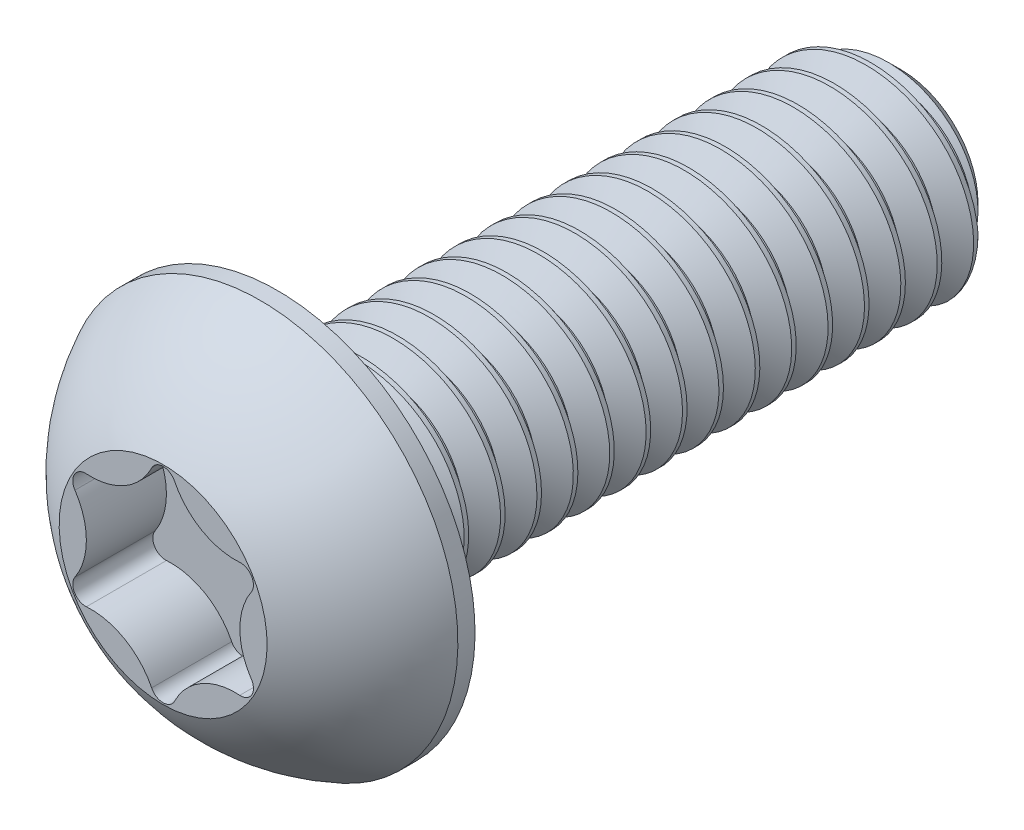
from build123d import *

# Parameters (mm, degrees)
SKETCH12_W         = 12
SKETCH12_H         = 2
CUT_EXTRUDE4_DEPTH = 1.54
CIRPATTERN1_COUNT  = 6
CHAMFER1_SIZE      = 0.525
CUT_SWEEP1_PITCH   = 0.7
CUT_SWEEP1_TO      = 12


with BuildPart() as part:
    # Sketch12 → Revolve1 (revolve)
    with BuildSketch(Plane(origin=(0, 0, 0), x_dir=(0, 0, -1), z_dir=(1, 0, 0))):
        with Locations((0, 1)):
            Rectangle(SKETCH12_W, SKETCH12_H)
    revolve(axis=Axis((0, 0, -6), (0, 0, 1)))

    # Sketch7 → Revolve2 (revolve)
    with BuildSketch(Plane(origin=(0, 0, 0), x_dir=(0, 0, -1), z_dir=(1, 0, 0)), mode=Mode.PRIVATE) as revolve2_sk:
        with BuildLine():
            Line((-6.33, 3.8), (-6, 3.8))
            Line((-6, 3.8), (-6, 0))
            Line((-6, 0), (-8.2, 0))
            Line((-8.2, 0), (-8.2, 2))
            ThreePointArc((-8.2, 2), (-7.406499853, 3.047002626), (-6.33, 3.8))
        make_face()
    revolve(revolve2_sk.sketch.rotate(Axis((0, 0, 8.2), (0, 0, -1)), 180), axis=Axis((0, 0, 8.2), (0, 0, -1)))

    # Sketch11 → Cut-Extrude4 (cut)
    with BuildSketch(Plane.XY.offset(8.2)):
        with BuildLine():
            Line((0, 0), (-1.704771007, 0.98425))
            ThreePointArc((-1.704771007, 0.98425), (-1.737604406, 0.853137928), (-1.696234895, 0.724464034))
            ThreePointArc((-1.696234895, 0.724464034), (-1.476375, 0), (-1.696234895, -0.724464034))
            ThreePointArc((-1.696234895, -0.724464034), (-1.737604406, -0.853137928), (-1.704771007, -0.98425))
            Line((-1.704771007, -0.98425), (0, 0))
        make_face()
    cut_extrude4 = extrude(amount=-CUT_EXTRUDE4_DEPTH, mode=Mode.SUBTRACT)

    # CirPattern1: Cut-Extrude4 ×6 about axis
    cirpattern1_axis = Axis((0, 0, 0), (0, 0, -1))
    for i in range(1, CIRPATTERN1_COUNT):
        add(cut_extrude4.rotate(cirpattern1_axis, i * 360 / CIRPATTERN1_COUNT), mode=Mode.SUBTRACT)

    # Chamfer1
    chamfer1_edges = [part.edges().sort_by_distance(p)[0] for p in [
        (0, -2, -6),
    ]]
    chamfer(chamfer1_edges, length=CHAMFER1_SIZE)


with BuildPart() as body_2:
    # Split1: read off the stored shape, not the designer's step
    # Split1: the piece on the far side of the plane
    add(part.part)
    split(bisect_by=Plane.XY.offset(6), keep=Keep.BOTTOM)

    # Cut-Sweep1: arcs per turn and ends read off the stored shape
    # Cut-Sweep1: the profile of Sketch14 screwed along a right-hand helix through 18.142857 turns, 6 arcs to a turn; built about Z, then put on its axis
    cut_sweep1_z = Axis((0, 0, 0), (0, 0, 1))
    cut_sweep1_corners = [(1.545336663, 0, -0.2625), (2.037888611, 0, 0.021875), (2.037888611, 0, -0.634375), (1.545336663, 0, -0.35)]
    with BuildLine(mode=Mode.PRIVATE) as cut_sweep1_profile:
        Line(cut_sweep1_corners[0], cut_sweep1_corners[1])
        Line(cut_sweep1_corners[1], cut_sweep1_corners[2])
        Line(cut_sweep1_corners[2], cut_sweep1_corners[3])
        Line(cut_sweep1_corners[3], cut_sweep1_corners[0])
    cut_sweep1_cap = Face(cut_sweep1_profile.wire())
    cut_sweep1_turn_angles = [0, 30, 60, 90, 120, 150, 180, 210, 240, 270, 300, 330, 360]
    cut_sweep1_turn_weights = [1, 0.8660254037844387, 1, 0.8660254037844387, 1, 0.8660254037844387, 1, 0.8660254037844387, 1, 0.8660254037844387, 1, 0.8660254037844387, 1]
    cut_sweep1_turn_rails = [Edge.make_bspline([Vector(p[0], p[1], 0).rotate(cut_sweep1_z, cut_sweep1_turn_angles[k]) / cut_sweep1_turn_weights[k] + Vector(0, 0, p[2] + CUT_SWEEP1_PITCH * cut_sweep1_turn_angles[k] / 360) for k in range(13)], [0, 0, 0, 1, 1, 2, 2, 3, 3, 4, 4, 5, 5, 6, 6, 6], 2, cut_sweep1_turn_weights) for p in cut_sweep1_corners]
    cut_sweep1_turn_sides = [Face.make_surface_from_curves(cut_sweep1_turn_rails[p[0]], cut_sweep1_turn_rails[p[1]]) for p in [(0, 1), (1, 2), (2, 3), (3, 0)]]
    cut_sweep1_last_angles = [6480, 6505.714285714, 6531.428571429]
    cut_sweep1_last_weights = [1, 0.9009688679025564, 1]
    cut_sweep1_last_rails = [Edge.make_bspline([Vector(p[0], p[1], 0).rotate(cut_sweep1_z, cut_sweep1_last_angles[k]) / cut_sweep1_last_weights[k] + Vector(0, 0, p[2] + CUT_SWEEP1_PITCH * cut_sweep1_last_angles[k] / 360) for k in range(3)], [0, 0, 0, 1, 1, 1], 2, cut_sweep1_last_weights) for p in cut_sweep1_corners]
    cut_sweep1_last_sides = [Face.make_surface_from_curves(cut_sweep1_last_rails[p[0]], cut_sweep1_last_rails[p[1]]) for p in [(0, 1), (1, 2), (2, 3), (3, 0)]]
    cut_sweep1 = Plane(origin=(0, 0, -6), x_dir=(0, 1, 0), z_dir=(0, 0, 1)) * split(Solid(Shell([*[p.moved(Location((0, 0, CUT_SWEEP1_PITCH * i))) for i in range(18) for p in cut_sweep1_turn_sides], *cut_sweep1_last_sides, cut_sweep1_cap, cut_sweep1_cap.rotate(cut_sweep1_z, 6531.428571429).moved(Location((0, 0, CUT_SWEEP1_PITCH * 6531.428571429 / 360)))])), bisect_by=Plane.XY.offset(CUT_SWEEP1_TO), keep=Keep.BOTTOM, mode=Mode.PRIVATE)
    add(cut_sweep1, mode=Mode.SUBTRACT)


with BuildPart() as part_1:
    add(part.part)

    # Split1
    split(bisect_by=Plane.XY.offset(6), keep=Keep.TOP)

    # Combine1: union body 2
    add(body_2.part)


solid = part_1.part
